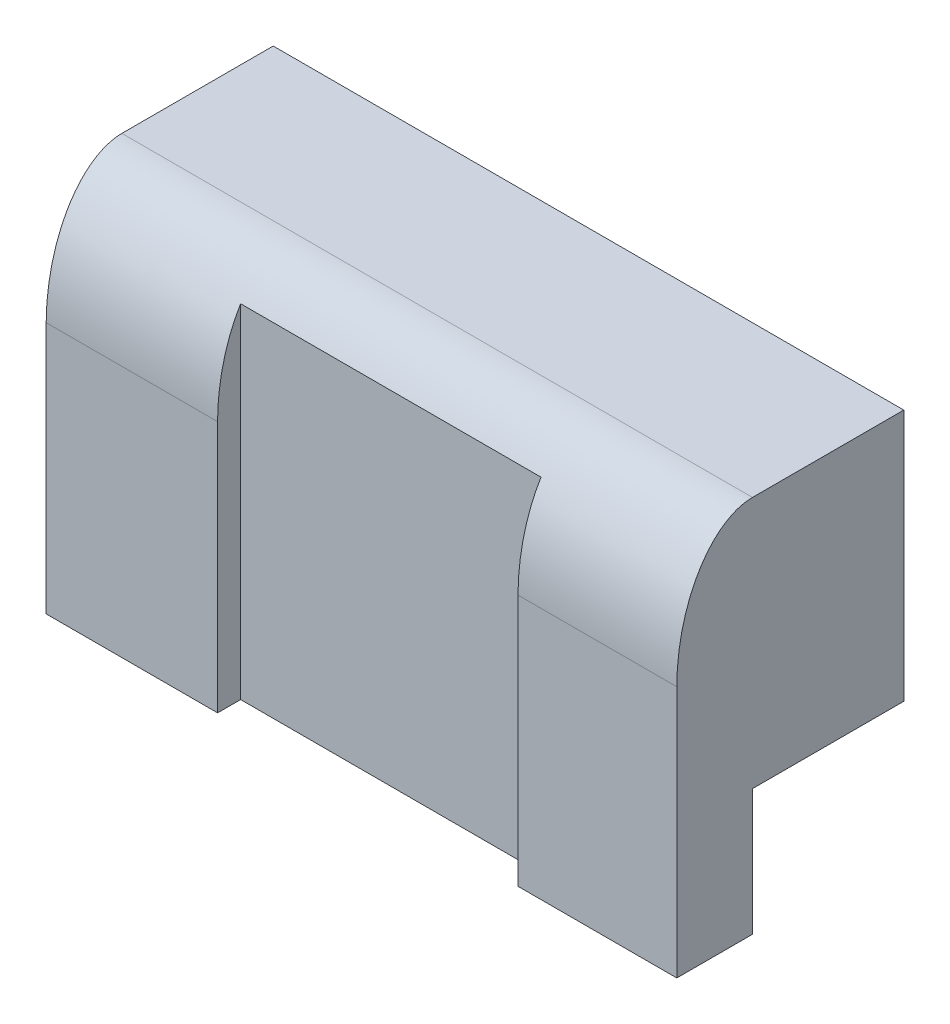
from build123d import *

# Parameters (mm, degrees)
SKETCH1_W                 = 3
SKETCH1_H                 = 15
BOSS_EXTRUDE1_DEPTH       = 25
SKETCH2_W                 = 25
SKETCH2_H                 = 10
BOSS_EXTRUDE2_DEPTH       = 6
FILLET1_SIZE              = 3
FILLET1_SIZE_2            = 5
F_3_0MM_DOWEL_HOLE1_D     = 3
F_3_0MM_DOWEL_HOLE1_DEPTH = 5
F_3_0MM_DOWEL_HOLE1_TIP   = 0.901290929
SKETCH5_W                 = 11.909967374
SKETCH5_H                 = 2.030245184
CUT_EXTRUDE1_DEPTH        = 18


with BuildPart() as part:
    # Sketch1 → Boss-Extrude1 (new body)
    with BuildSketch(Plane(origin=(0, 0, 0), x_dir=(0, 0, -1), z_dir=(1, 0, 0))):
        with Locations((1.5, 7.5)):
            Rectangle(SKETCH1_W, SKETCH1_H)
    extrude(amount=BOSS_EXTRUDE1_DEPTH)

    # Sketch2 → Boss-Extrude2 (add)
    with BuildSketch(Plane(origin=(0, 0, -3), x_dir=(-1, 0, 0), z_dir=(0, 0, -1))):
        with Locations((-12.5, 10)):
            Rectangle(SKETCH2_W, SKETCH2_H)
    extrude(amount=BOSS_EXTRUDE2_DEPTH)

    # Fillet1
    # an asymmetric fillet: 5, 3 mm, written as the material it takes off along each edge
    with BuildSketch(Plane(origin=(-12.5, 15, 0), x_dir=(0, 0, -1), z_dir=(1, 0, 0))) as fillet1_piece_1:
        with BuildLine():
            Bezier((FILLET1_SIZE, 0), (0, 0), (0, -FILLET1_SIZE_2), weights=[1, 0.707106781, 1])
            Line((0, -FILLET1_SIZE_2), (0, 0))
            Line((0, 0), (FILLET1_SIZE, 0))
        make_face()
    extrude(amount=50, mode=Mode.SUBTRACT)

    # Ø3.0mm Dowel Hole1
    with Locations(Plane(origin=(0, 5, 0), x_dir=(-1, 0, 0), z_dir=(0, -1, 0))):
        with Locations((-3, 6), (-18, 6), (-7, 6), (-22, 6)):
            Hole(F_3_0MM_DOWEL_HOLE1_D / 2, depth=F_3_0MM_DOWEL_HOLE1_DEPTH)
            with Locations((0, 0, -(F_3_0MM_DOWEL_HOLE1_DEPTH + F_3_0MM_DOWEL_HOLE1_TIP / 2))):  # 118° drill point
                Cone(0, F_3_0MM_DOWEL_HOLE1_D / 2, F_3_0MM_DOWEL_HOLE1_TIP, mode=Mode.SUBTRACT)

    # Sketch5 → Cut-Extrude1 (cut)
    with BuildSketch(Plane(origin=(0, 15, 0), x_dir=(1, 0, 0), z_dir=(0, 1, 0))):
        with Locations((12.749835557, -0.102167309)):
            Rectangle(SKETCH5_W, SKETCH5_H)
    extrude(amount=-CUT_EXTRUDE1_DEPTH, mode=Mode.SUBTRACT)


solid = part.part
